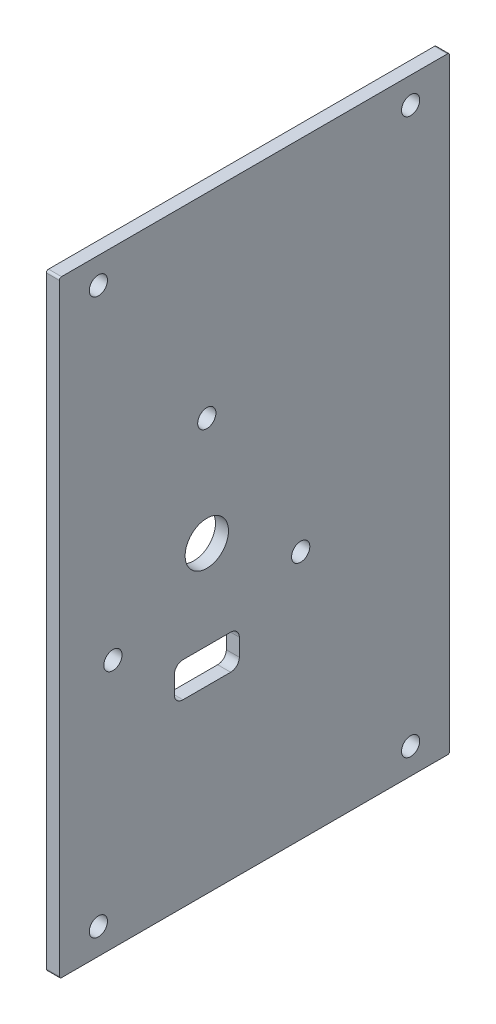
from build123d import *

# Parameters (mm, degrees)
SKETCH1_W           = 90
SKETCH1_H           = 140
SKETCH1_R           = 5
SKETCH1_R_2         = 2.1
BOSS_EXTRUDE1_DEPTH = 3
FILLET1_R           = 0.5


with BuildPart() as part:
    # Sketch1 → Boss-Extrude1 (new body)
    with BuildSketch(Plane(origin=(0, 0, 0), x_dir=(0, 0, -1), z_dir=(1, 0, 0))):
        with Locations((45, -70)):
            Rectangle(SKETCH1_W, SKETCH1_H)
        with Locations((34, -70)):
            Circle(SKETCH1_R, mode=Mode.SUBTRACT)
        with Locations((34, -45)):
            Circle(SKETCH1_R_2, mode=Mode.SUBTRACT)
        with Locations((55.650635095, -82.5)):
            Circle(SKETCH1_R_2, mode=Mode.SUBTRACT)
        with Locations((12.349364905, -82.5)):
            Circle(SKETCH1_R_2, mode=Mode.SUBTRACT)
        with Locations((9, -6)):
            Circle(SKETCH1_R_2, mode=Mode.SUBTRACT)
        with Locations((81, -6)):
            Circle(SKETCH1_R_2, mode=Mode.SUBTRACT)
        with Locations((81, -134)):
            Circle(SKETCH1_R_2, mode=Mode.SUBTRACT)
        with Locations((9, -134)):
            Circle(SKETCH1_R_2, mode=Mode.SUBTRACT)
        with BuildLine():
            Line((34, -90.5), (28.5, -90.5))
            ThreePointArc((28.5, -90.5), (27.085786438, -91.085786438), (26.5, -92.5))
            Line((26.5, -92.5), (26.5, -96.5))
            ThreePointArc((26.5, -96.5), (27.085786438, -97.914213562), (28.5, -98.5))
            Line((28.5, -98.5), (39.5, -98.5))
            ThreePointArc((39.5, -98.5), (40.914213562, -97.914213562), (41.5, -96.5))
            Line((41.5, -96.5), (41.5, -92.5))
            ThreePointArc((41.5, -92.5), (40.914213562, -91.085786438), (39.5, -90.5))
            Line((39.5, -90.5), (34, -90.5))
        make_face(mode=Mode.SUBTRACT)
    extrude(amount=BOSS_EXTRUDE1_DEPTH)

    # Fillet1
    fillet1_edges = [part.edges().sort_by_distance(p)[0] for p in [
        (1.5, -140, -90),
        (1.5, -140, 0),
        (1.5, 0, -90),
        (1.5, 0, 0),
    ]]
    fillet(fillet1_edges, radius=FILLET1_R)


solid = part.part
